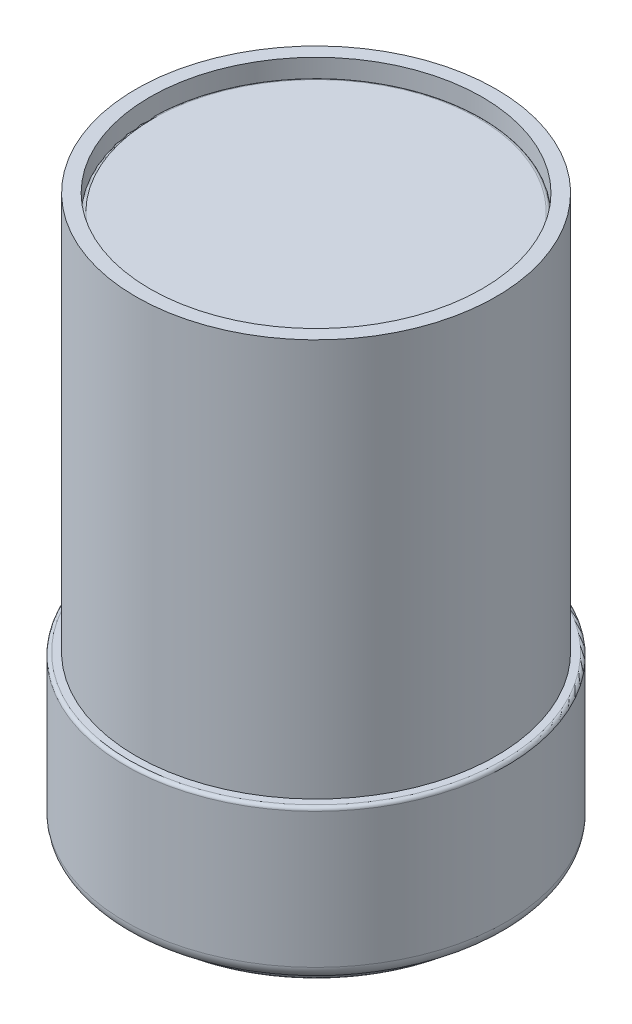
from build123d import *

# Parameters (mm, degrees)
BOSS_EXTRUDE1_DEPTH      = 169.7
BOSS_EXTRUDE1_DEPTH_BACK = 63.5
SKETCH1_R                = 76.2
SHELL1_T                 = 6.35
SKETCH2_R                = 80.9625
BOSS_EXTRUDE2_DEPTH      = 63.5
SHELL3_T                 = 6.35
FILLET1_R                = 1.524
FILLET2_R                = 6.35
BOSS_EXTRUDE3_START      = 6.35
SKETCH3_R                = 76.2
SKETCH3_R_2              = 69.85
BOSS_EXTRUDE3_DEPTH      = 6.35
FILLET3_R                = 6.35
FILLET4_R                = 1.524
SKETCH4_R                = 76.2
BOSS_EXTRUDE4_DEPTH      = 225.425
FILLET5_R                = 1.524


# Some blends are built 0.0001 mm under size
with BuildPart() as part:
    # Sketch1 → Boss-Extrude1 (new, two sides: drawn at the far end of the back side and taken through both)
    with BuildSketch(Plane(origin=(0, 0, 0), x_dir=(1, 0, 0), z_dir=(0, 1, 0)).offset(-BOSS_EXTRUDE1_DEPTH_BACK)):
        with Locations(Location((0, 0, 0), (0, 0, 270))):
            Circle(SKETCH1_R)
    extrude(amount=BOSS_EXTRUDE1_DEPTH + BOSS_EXTRUDE1_DEPTH_BACK)

    # Shell1
    shell1_openings = [part.faces().sort_by_distance(p)[0] for p in [
        (0, 169.7, 0),
    ]]
    offset(amount=SHELL1_T, openings=shell1_openings, kind=Kind.INTERSECTION)


with BuildPart() as body_2:
    # Sketch2 → Boss-Extrude2 (new body)
    with BuildSketch(Plane.XZ.offset(76.2)):
        with Locations(Location((0, 0, 0), (0, 0, 270))):
            Circle(SKETCH2_R)
    extrude(amount=-BOSS_EXTRUDE2_DEPTH)

    # Shell3
    shell3_openings = [body_2.faces().sort_by_distance(p)[0] for p in [
        (0, -12.7, 0),
    ]]
    offset(amount=SHELL3_T, openings=shell3_openings, kind=Kind.INTERSECTION)

    # Fillet1
    # the kernel refuses this fillet: 1.524 mm, written as the material it takes off along each edge
    with BuildSketch(Plane(origin=(0, -12.7, 0), x_dir=(0, 0, -1), z_dir=(-1, 0, 0))) as fillet1_piece_1:
        with BuildLine():
            CenterArc((87.3125 - FILLET1_R, FILLET1_R), FILLET1_R, 270, 90)
            Line((87.3125, FILLET1_R), (87.3125, 0))
            Line((87.3125, 0), (87.3125 - FILLET1_R, 0))
        make_face()
    revolve(axis=Axis((0, -12.7, 0), (0, -1, 0)), mode=Mode.SUBTRACT)
    with BuildSketch(Plane(origin=(0, -12.7, 0), x_dir=(0, 0, -1), z_dir=(-1, 0, 0))) as fillet1_piece_2:
        with BuildLine():
            CenterArc((80.9625 + FILLET1_R, FILLET1_R), FILLET1_R, 180, 90)
            Line((80.9625 + FILLET1_R, 0), (80.9625, 0))
            Line((80.9625, 0), (80.9625, FILLET1_R))
        make_face()
    revolve(axis=Axis((0, -12.7, 0), (0, -1, 0)), mode=Mode.SUBTRACT)

    # Fillet2
    fillet2_edges = [body_2.edges().sort_by_distance(p)[0] for p in [
        (0, -82.55, 87.3125),
    ]]
    fillet(fillet2_edges, radius=FILLET2_R)

    # Sketch3 → Boss-Extrude3 (add)
    with BuildSketch(Plane.XZ.offset(82.55).offset(BOSS_EXTRUDE3_START)):
        with Locations(Location((0, 0, 0), (0, 0, 270))):
            Circle(SKETCH3_R)
        with Locations(Location((0, 0, 0), (0, 0, 270))):
            Circle(SKETCH3_R_2, mode=Mode.SUBTRACT)
    extrude(amount=-BOSS_EXTRUDE3_DEPTH)

    # Fillet3
    fillet3_edges = [body_2.edges().sort_by_distance(p)[0] for p in [
        (0, -82.55, 76.2),
    ]]
    fillet(fillet3_edges, radius=FILLET3_R - 0.0001)  # a hair under: the kernel refuses the full size

    # Fillet4
    fillet4_edges = [body_2.edges().sort_by_distance(p)[0] for p in [
        (0, -88.9, 69.85),
        (0, -88.9, 76.2),
    ]]
    fillet(fillet4_edges, radius=FILLET4_R)


with BuildPart() as body_3:
    # Sketch4 → Boss-Extrude4 (new body)
    with BuildSketch(Plane(origin=(0, -63.5, 0), x_dir=(1, 0, 0), z_dir=(0, 1, 0))):
        with Locations(Location((0, 0, 0), (0, 0, 90))):
            Circle(SKETCH4_R)
    extrude(amount=BOSS_EXTRUDE4_DEPTH)

    # Fillet5
    fillet5_edges = [body_3.edges().sort_by_distance(p)[0] for p in [
        (0, 161.925, 76.2),
    ]]
    fillet(fillet5_edges, radius=FILLET5_R)


solid = Compound([part.part, body_2.part, body_3.part])
